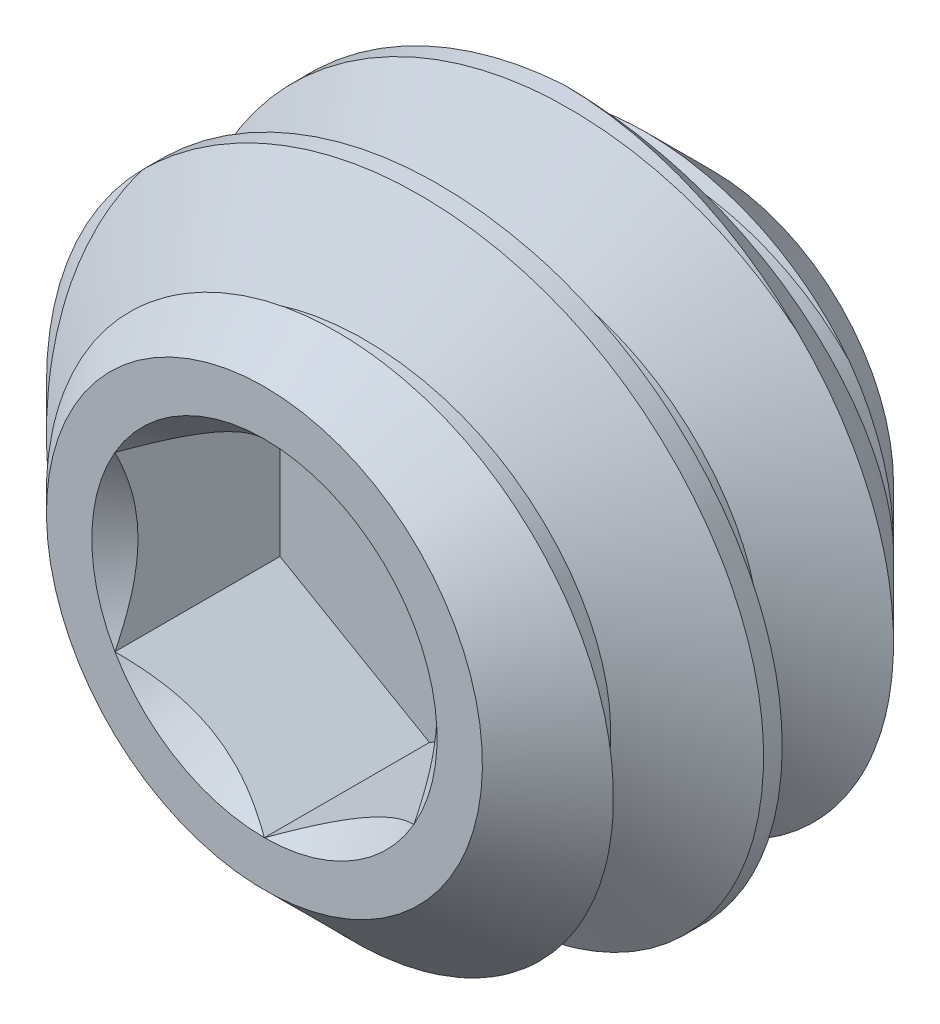
from build123d import *

# Parameters (mm, degrees)
CHAMFER1_SIZE      = 0.79375
CUT_EXTRUDE1_START = -0.8763
CUT_EXTRUDE1_DEPTH = 0.8763
SKETCH4_R          = 0.916543552
CUT_EXTRUDE2_DEPTH = 0.8763
CUT_EXTRUDE2_TAPER = 45
CUT_SWEEP1_PITCH   = 0.79375


with BuildPart() as part:
    # Sketch2 → Revolve1 (revolve)
    with BuildSketch(Plane(origin=(0, 0, 0), x_dir=(0, 0, -1), z_dir=(1, 0, 0))):
        Polygon((1.190625, 0.909240625), (0.644298115, 0), (-1.190625, 0), (-1.190625, 1.1572875), (-0.5953125, 1.7526), (1.190625, 1.7526), align=None)
    revolve(axis=Axis((0, 0, -0.644298115), (0, 0, 1)))

    # Chamfer1
    chamfer1_edges = [part.edges().sort_by_distance(p)[0] for p in [
        (0, -1.7526, -1.190625),
    ]]
    chamfer(chamfer1_edges, length=CHAMFER1_SIZE)

    # Sketch3 → Cut-Extrude1 (cut)
    with BuildSketch(Plane.XY.offset(1.190625).offset(CUT_EXTRUDE1_START)):
        Polygon((-0.79375, -0.458271776), (0, -0.916543552), (0.79375, -0.458271776), (0.79375, 0.458271776), (0, 0.916543552), (-0.79375, 0.458271776), align=None)
    extrude(amount=CUT_EXTRUDE1_DEPTH, mode=Mode.SUBTRACT)

    # Sketch4 → Cut-Extrude2 (cut)
    with BuildSketch(Plane.XY.offset(1.190625)):
        Circle(SKETCH4_R)
    extrude(amount=-CUT_EXTRUDE2_DEPTH, taper=CUT_EXTRUDE2_TAPER, mode=Mode.SUBTRACT)

    # Cut-Sweep1: the profile of Sketch8 screwed along a right-hand helix of 4.01 turns, 8 arcs to a turn; built about Z, then put on its axis
    cut_sweep1_z = Axis((0, 0, 0), (0, 0, 1))
    cut_sweep1_corners = [(1.237044252, 0, -0.396875), (1.237044252, 0, -0.29765625), (1.795562979, 0, 0.024804687), (1.795562979, 0, -0.719335938)]
    with BuildLine(mode=Mode.PRIVATE) as cut_sweep1_profile:
        Line(cut_sweep1_corners[0], cut_sweep1_corners[1])
        Line(cut_sweep1_corners[1], cut_sweep1_corners[2])
        Line(cut_sweep1_corners[2], cut_sweep1_corners[3])
        Line(cut_sweep1_corners[3], cut_sweep1_corners[0])
    cut_sweep1_cap = Face(cut_sweep1_profile.wire())
    cut_sweep1_turn_angles = [0, 22.5, 45, 67.5, 90, 112.5, 135, 157.5, 180, 202.5, 225, 247.5, 270, 292.5, 315, 337.5, 360]
    cut_sweep1_turn_weights = [1, 0.9238795325112867, 1, 0.9238795325112867, 1, 0.9238795325112867, 1, 0.9238795325112867, 1, 0.9238795325112867, 1, 0.9238795325112867, 1, 0.9238795325112867, 1, 0.9238795325112867, 1]
    cut_sweep1_turn_rails = [Edge.make_bspline([Vector(p[0], p[1], 0).rotate(cut_sweep1_z, cut_sweep1_turn_angles[k]) / cut_sweep1_turn_weights[k] + Vector(0, 0, p[2] + CUT_SWEEP1_PITCH * cut_sweep1_turn_angles[k] / 360) for k in range(17)], [0, 0, 0, 1, 1, 2, 2, 3, 3, 4, 4, 5, 5, 6, 6, 7, 7, 8, 8, 8], 2, cut_sweep1_turn_weights) for p in cut_sweep1_corners]
    cut_sweep1_turn_sides = [Face.make_surface_from_curves(cut_sweep1_turn_rails[p[0]], cut_sweep1_turn_rails[p[1]]) for p in [(0, 1), (1, 2), (2, 3), (3, 0)]]
    cut_sweep1_last_angles = [1440, 1441.8, 1443.6]
    cut_sweep1_last_weights = [1, 0.9995065603657299, 1]
    cut_sweep1_last_rails = [Edge.make_bspline([Vector(p[0], p[1], 0).rotate(cut_sweep1_z, cut_sweep1_last_angles[k]) / cut_sweep1_last_weights[k] + Vector(0, 0, p[2] + CUT_SWEEP1_PITCH * cut_sweep1_last_angles[k] / 360) for k in range(3)], [0, 0, 0, 1, 1, 1], 2, cut_sweep1_last_weights) for p in cut_sweep1_corners]
    cut_sweep1_last_sides = [Face.make_surface_from_curves(cut_sweep1_last_rails[p[0]], cut_sweep1_last_rails[p[1]]) for p in [(0, 1), (1, 2), (2, 3), (3, 0)]]
    cut_sweep1 = Plane(origin=(0, 0, -1.190625), x_dir=(0, 1, 0), z_dir=(0, 0, 1)) * Solid(Shell([*[p.moved(Location((0, 0, CUT_SWEEP1_PITCH * i))) for i in range(4) for p in cut_sweep1_turn_sides], *cut_sweep1_last_sides, cut_sweep1_cap, cut_sweep1_cap.rotate(cut_sweep1_z, 1443.6).moved(Location((0, 0, CUT_SWEEP1_PITCH * 1443.6 / 360)))]))
    add(cut_sweep1, mode=Mode.SUBTRACT)


solid = part.part
